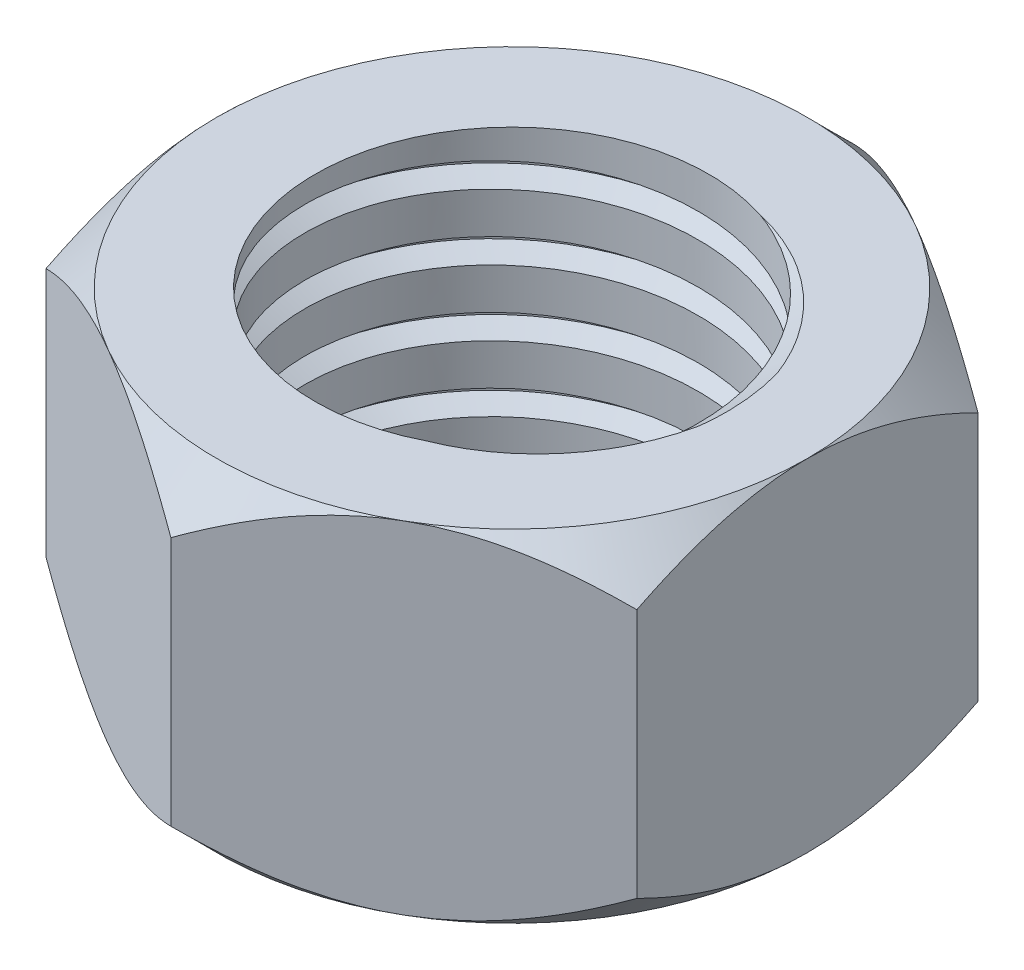
from build123d import *

# Parameters (mm, degrees)
BOSS_EXTRUDE1_DEPTH     = 5.2
SKETCH9_OUTSIDE_W       = 62.356
SKETCH9_OUTSIDE_H       = 65.14
SKETCH9_OUTSIDE_R       = 9
CUT_EXTRUDE3_DEPTH      = 18.238329385
CUT_EXTRUDE3_DRAFT      = -45
MIRROR1_COPY_1_SKETCH_W = 62.356
MIRROR1_COPY_1_SKETCH_H = 65.14
MIRROR1_COPY_1_SKETCH_R = 9
MIRROR1_COPY_1_DEPTH    = 18.238329385
MIRROR1_COPY_1_DRAFT    = -45
SKETCH10_R              = 6
CUT_EXTRUDE4_DEPTH      = 18.238329385
THREAD1_PITCH           = 2


with BuildPart() as part:
    # Sketch1 → Boss-Extrude1 (new, symmetric)
    with BuildSketch(Plane(origin=(0, 0, 0), x_dir=(1, 0, 0), z_dir=(0, 1, 0))):
        Polygon((0, 10.392304845), (-9, 5.196152423), (-9, -5.196152423), (0, -10.392304845), (9, -5.196152423), (9, 5.196152423), align=None)
    extrude(amount=BOSS_EXTRUDE1_DEPTH, both=True)


with BuildPart() as cut_extrude3_tool:
    # Sketch9 outside → Cut-Extrude3 (with draft: the straight prism first)
    with BuildSketch(Plane(origin=(0, 5.2, 0), x_dir=(1, 0, 0), z_dir=(0, 1, 0))):
        Rectangle(SKETCH9_OUTSIDE_W, SKETCH9_OUTSIDE_H)
        Circle(SKETCH9_OUTSIDE_R, mode=Mode.SUBTRACT)
    extrude(amount=-CUT_EXTRUDE3_DEPTH)
    # Cut-Extrude3: the draft: its side faces are tilted about the plane it starts from
    cut_extrude3_sides = [cut_extrude3_tool.faces().sort_by_distance(p)[0] for p in [
        (0, -3.919164693, 32.57),
        (31.178, -3.919164693, 0),
        (0, -3.919164693, -32.57),
        (-31.178, -3.919164693, 0),
        (-9, -3.919164693, 0),
    ]]
    draft(cut_extrude3_sides, Plane(origin=(0, 5.2, 0), x_dir=(1, 0, 0), z_dir=(0, 1, 0)), CUT_EXTRUDE3_DRAFT)


with BuildPart() as part_1:
    add(part.part)

    # Cut-Extrude3: cut by cut_extrude3_tool
    add(cut_extrude3_tool.part, mode=Mode.SUBTRACT)


with BuildPart() as mirror1_copy_1_tool:
    # Mirror1 copy 1 sketch → Mirror1 copy 1 (with draft: the straight prism first)
    with BuildSketch(Plane.XZ.offset(5.2)):
        Rectangle(MIRROR1_COPY_1_SKETCH_W, MIRROR1_COPY_1_SKETCH_H)
        Circle(MIRROR1_COPY_1_SKETCH_R, mode=Mode.SUBTRACT)
    extrude(amount=-MIRROR1_COPY_1_DEPTH)
    # Mirror1 copy 1: the draft: its side faces are tilted about the plane it starts from
    mirror1_copy_1_sides = [mirror1_copy_1_tool.faces().sort_by_distance(p)[0] for p in [
        (0, 3.919164693, 32.57),
        (31.178, 3.919164693, 0),
        (0, 3.919164693, -32.57),
        (-31.178, 3.919164693, 0),
        (-9, 3.919164693, 0),
    ]]
    draft(mirror1_copy_1_sides, Plane.XZ.offset(5.2), MIRROR1_COPY_1_DRAFT)


with BuildPart() as part_2:
    add(part_1.part)

    # Mirror1 copy 1: cut by mirror1_copy_1_tool
    add(mirror1_copy_1_tool.part, mode=Mode.SUBTRACT)

    # Sketch10 → Cut-Extrude4 (cut, through all)
    with BuildSketch(Plane(origin=(0, 5.2, 0), x_dir=(1, 0, 0), z_dir=(0, 1, 0))):
        with Locations(Location((0, 0, 0), (0, 0, 270))):
            Circle(SKETCH10_R)
    extrude(amount=-CUT_EXTRUDE4_DEPTH, mode=Mode.SUBTRACT)

    # Thread1: arcs per turn and ends read off the stored shape
    # Thread1: the profile of Thread Profile2 profile screwed along a right-hand helix through 6.2 turns, 10 arcs to a turn; built about Z, then put on its axis
    thread1_z = Axis((0, 0, 0), (0, 0, 1))
    thread1_corners = [(5.9997, 0, -0.000173205), (6.541265875, 0, 0.312499999), (6.541265875, 0, 0.437499999), (5.9997, 0, 0.750173202)]
    with BuildLine(mode=Mode.PRIVATE) as thread1_profile:
        Line(thread1_corners[0], thread1_corners[1])
        Line(thread1_corners[1], thread1_corners[2])
        Line(thread1_corners[2], thread1_corners[3])
        Line(thread1_corners[3], thread1_corners[0])
    thread1_cap = Face(thread1_profile.wire())
    thread1_turn_angles = [0, 18, 36, 54, 72, 90, 108, 126, 144, 162, 180, 198, 216, 234, 252, 270, 288, 306, 324, 342, 360]
    thread1_turn_weights = [1, 0.9510565162951535, 1, 0.9510565162951535, 1, 0.9510565162951535, 1, 0.9510565162951535, 1, 0.9510565162951535, 1, 0.9510565162951535, 1, 0.9510565162951535, 1, 0.9510565162951535, 1, 0.9510565162951535, 1, 0.9510565162951535, 1]
    thread1_turn_rails = [Edge.make_bspline([Vector(p[0], p[1], 0).rotate(thread1_z, thread1_turn_angles[k]) / thread1_turn_weights[k] + Vector(0, 0, p[2] + THREAD1_PITCH * thread1_turn_angles[k] / 360) for k in range(21)], [0, 0, 0, 1, 1, 2, 2, 3, 3, 4, 4, 5, 5, 6, 6, 7, 7, 8, 8, 9, 9, 10, 10, 10], 2, thread1_turn_weights) for p in thread1_corners]
    thread1_turn_sides = [Face.make_surface_from_curves(thread1_turn_rails[p[0]], thread1_turn_rails[p[1]]) for p in [(0, 1), (1, 2), (2, 3), (3, 0)]]
    thread1_last_angles = [2160, 2178, 2196, 2214, 2232]
    thread1_last_weights = [1, 0.9510565162951535, 1, 0.9510565162951535, 1]
    thread1_last_rails = [Edge.make_bspline([Vector(p[0], p[1], 0).rotate(thread1_z, thread1_last_angles[k]) / thread1_last_weights[k] + Vector(0, 0, p[2] + THREAD1_PITCH * thread1_last_angles[k] / 360) for k in range(5)], [0, 0, 0, 1, 1, 2, 2, 2], 2, thread1_last_weights) for p in thread1_corners]
    thread1_last_sides = [Face.make_surface_from_curves(thread1_last_rails[p[0]], thread1_last_rails[p[1]]) for p in [(0, 1), (1, 2), (2, 3), (3, 0)]]
    thread1 = Plane(origin=(0, -7.2, 0), x_dir=(1, 0, 0), z_dir=(0, 1, 0)) * Solid(Shell([*[p.moved(Location((0, 0, THREAD1_PITCH * i))) for i in range(6) for p in thread1_turn_sides], *thread1_last_sides, thread1_cap, thread1_cap.rotate(thread1_z, 2232).moved(Location((0, 0, THREAD1_PITCH * 2232 / 360)))]))
    add(thread1, mode=Mode.SUBTRACT)


solid = part_2.part
